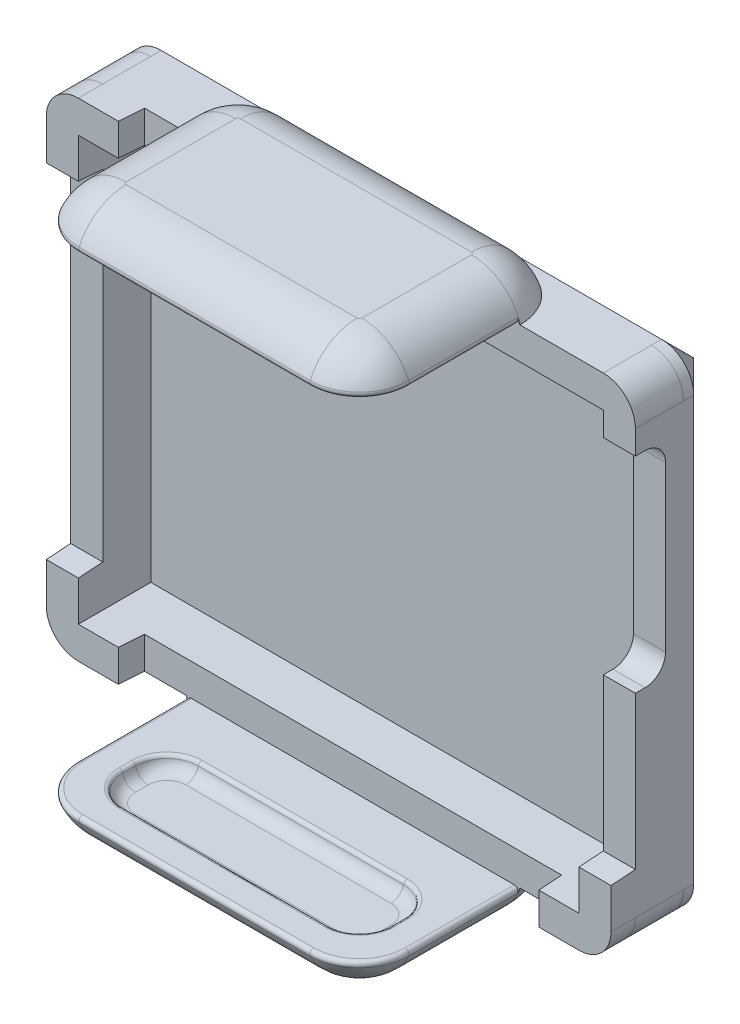
from build123d import *
from build123d.topology import SkipClean

# Parameters (mm, degrees)
WALLS_START                  = 1.526776695
WALLS_DEPTH                  = 1.87242011
BASE_START                   = 3.399196
BASE_DEPTH                   = 1.65
CUT_USB_HOLE_DEPTH           = 1.25
CHAMFER_DESQUISH_SIZE        = 1.25
SKETCH4_W                    = 13
SKETCH4_H                    = 8.27241931
EXTRUDE_TAB1_DEPTH           = 1.4
FILLET_TAB1_R                = 2
EXTRUDE_START                = -19
SKETCH4_3_W                  = 13
SKETCH4_3_H                  = 8.27241931
EXTRUDE_TAB2_DEPTH           = 1.4
FILLET_TAB2_R                = 2
FILLET_TAB_SIDES_R           = 2
CUT_TAB_HOLE_2_DEPTH         = 0.51
CUT_START                    = -19
CUT_TAB_HOLE_1_DEPTH         = 0.51
FILL_TAB_HOLES_INNER_R       = 0.5
FILLET_TAB_EDGE_R            = 0.15
EXTRUDE_START_2              = 0.95
EXTRUDE_ALIGNMENT_TABS_DEPTH = 0.95
DRAFT_ALIGNMENT_TABS_ANGLE   = 4
FILLET1_R                    = 0.15


with BuildPart() as part:
    # walls: read off the stored shape, not the designer's step
    # walls outline → walls (new body)
    with BuildSketch(Plane(origin=(0, 0, -0.80080358), x_dir=(-1, 0, 0), z_dir=(0, 0, -1)).offset(WALLS_START)):
        with BuildLine():
            ThreePointArc((0.25, -1.499999918), (1.13388369, -1.133883181), (1.5, -0.249999313))
            Line((1.5, -0.249999313), (1.5, 16.250000082))
            ThreePointArc((1.5, 16.250000082), (1.133883476, 17.133883558), (0.25, 17.500000082))
            Line((0.25, 17.500000082), (-19.25, 17.500000082))
            ThreePointArc((-19.25, 17.500000082), (-20.133883476, 17.133883558), (-20.5, 16.250000082))
            Line((-20.5, 16.250000082), (-20.5, -0.249999313))
            ThreePointArc((-20.5, -0.249999313), (-20.133883691, -1.133883181), (-19.25, -1.499999918))
            Line((-19.25, -1.499999918), (0.25, -1.499999918))
        make_face()
        Polygon((-19.25, -0.25), (-19.25, 16.250001374), (0.25, 16.250000073), (0.25, -0.25), align=None, mode=Mode.SUBTRACT)
    extrude(amount=WALLS_DEPTH)

    # Sketch1<3> → base (add)
    with BuildSketch(Plane(origin=(0, 0, -0.80080358), x_dir=(-1, 0, 0), z_dir=(0, 0, -1)).offset(BASE_START)):
        with BuildLine():
            Line((0.25, 17.5), (-19.25, 17.5))
            ThreePointArc((-19.25, 17.5), (-20.133883476, 17.133883476), (-20.5, 16.25))
            Line((-20.5, 16.25), (-20.5, -0.25))
            ThreePointArc((-20.5, -0.25), (-20.133883476, -1.133883476), (-19.25, -1.5))
            Line((-19.25, -1.5), (0.25, -1.5))
            ThreePointArc((0.25, -1.5), (1.133883476, -1.133883476), (1.5, -0.25))
            Line((1.5, -0.25), (1.5, 16.25))
            ThreePointArc((1.5, 16.25), (1.133883476, 17.133883476), (0.25, 17.5))
        make_face()
    extrude(amount=BASE_DEPTH)

    # Sketch3 → cut usb hole (cut)
    with BuildSketch(Plane(origin=(20.5, 0, 0), x_dir=(0, 0, -1), z_dir=(1, 0, 0))):
        with BuildLine():
            Line((1.388671546, 15.085909165), (0.785118155, 14.482355774))
            ThreePointArc((0.785118155, 14.482355774), (0.611699954, 14.222817095), (0.55080358, 13.916670349))
            Line((0.55080358, 13.916670349), (0.55080358, 11.33022374))
            Line((0.55080358, 11.33022374), (0.55080358, 11.31022374))
            Line((0.55080358, 11.31022374), (0.55080358, 8.723777131))
            ThreePointArc((0.55080358, 8.723777131), (0.611699954, 8.417630385), (0.785118155, 8.158091706))
            Line((0.785118155, 8.158091706), (1.388671546, 7.554538315))
            ThreePointArc((1.388671546, 7.554538315), (1.648210225, 7.381120114), (1.954356971, 7.32022374))
            Line((1.954356971, 7.32022374), (2.70080358, 7.32022374))
            ThreePointArc((2.70080358, 7.32022374), (3.266489005, 7.554538315), (3.50080358, 8.12022374))
            Line((3.50080358, 8.12022374), (3.50080358, 14.52022374))
            ThreePointArc((3.50080358, 14.52022374), (3.266489005, 15.085909165), (2.70080358, 15.32022374))
            Line((2.70080358, 15.32022374), (1.954356971, 15.32022374))
            ThreePointArc((1.954356971, 15.32022374), (1.648210225, 15.259327366), (1.388671546, 15.085909165))
        make_face()
    extrude(amount=-CUT_USB_HOLE_DEPTH, mode=Mode.SUBTRACT)

    # chamfer desquish
    chamfer_desquish_edges = [part.edges().sort_by_distance(p)[0] for p in [
        (9.5, 17.5, -5.84999958),
        (20.133883476, 17.133883476, -5.84999958),
        (-1.133883476, 17.133883476, -5.84999958),
        (20.5, 8, -5.84999958),
        (-1.5, 8, -5.84999958),
        (20.133883476, -1.133883476, -5.84999958),
        (-1.133883476, -1.133883476, -5.84999958),
        (9.5, -1.5, -5.84999958),
    ]]
    chamfer(chamfer_desquish_edges, length=CHAMFER_DESQUISH_SIZE - 0.0001)  # a hair under: the kernel refuses the full size

    # Sketch4 → extrude tab1 (add)
    with BuildSketch(Plane(origin=(0, -1.500000102, -6.6e-08), x_dir=(1, 0, 0), z_dir=(0, -0.999999999999999, -4.371140900000006e-08))):
        with Locations((9.5, -0.213790695)):
            Rectangle(SKETCH4_W, SKETCH4_H)
    extrude(amount=EXTRUDE_TAB1_DEPTH)

    # fillet tab1
    fillet_tab1_edges = [part.edges().sort_by_distance(p)[0] for p in [
        (16, -2.199999912, -4.350000446),
        (16, -2.200000273, 3.922418864),
        (3, -2.200000273, 3.922418864),
        (3, -2.199999912, -4.350000446),
    ]]
    fillet(fillet_tab1_edges, radius=FILLET_TAB1_R)

    # Sketch4<3> → extrude tab2 (add)
    with BuildSketch(Plane(origin=(0, -1.500000102, -6.6e-08), x_dir=(1, 0, 0), z_dir=(0, -0.999999999999999, -4.371140900000006e-08)).offset(EXTRUDE_START)):
        with Locations((9.5, -0.213790695)):
            Rectangle(SKETCH4_3_W, SKETCH4_3_H)
    extrude(amount=-EXTRUDE_TAB2_DEPTH)

    # fillet tab2
    fillet_tab2_edges = [part.edges().sort_by_distance(p)[0] for p in [
        (3, 18.200000088, -4.349999554),
        (3, 18.199999727, 3.922419755),
        (16, 18.199999727, 3.922419755),
        (16, 18.200000088, -4.349999554),
    ]]
    fillet(fillet_tab2_edges, radius=FILLET_TAB2_R)

    # fillet tab sides
    # the kernel refuses this fillet: 2 mm, written as the material it takes off along each edge
    with BuildSketch(Plane(origin=(5, 18.899999727, 3.922419786), x_dir=(0, 4.371140875977686e-08, -0.9999999999999991), z_dir=(1, 0, 0))) as fillet_tab_sides_piece_1:
        with BuildLine():
            CenterArc((1.907878403, -2), FILLET_TAB_SIDES_R, 90, 72.542396876)
            Line((0, -1.4), (-0.038157568, -1.388))
            ThreePointArc((-0.038157568, -1.388), (-0.04, -0.7), (-0.04, 0))
            Line((-0.04, 0), (0, 0.04))
            Line((0, 0.04), (1.907878403, 0.04))
            Line((1.907878403, 0.04), (1.907878403, 0))
        make_face()
    extrude(amount=9, mode=Mode.SUBTRACT)
    with BuildSketch(Plane(origin=(5, 18.899999814, 1.922419786), x_dir=(-1, 0, 0), z_dir=(0, 4.3711409000000074e-08, -0.9999999999999991))) as fillet_tab_sides_piece_2:
        with BuildLine():
            CenterArc((0.092121597, -2), FILLET_TAB_SIDES_R, 17.457603124, 72.542396876)
            Line((2, -1.4), (2.038157568, -1.388))
            ThreePointArc((2.038157568, -1.388), (2.04, -0.7), (2.04, 0))
            Line((2.04, 0), (2, 0.04))
            Line((2, 0.04), (0.092121597, 0.04))
            Line((0.092121597, 0.04), (0.092121597, 0))
        make_face()
    revolve(axis=Axis((5, 18.899999814, 1.922419786), (0, 0.9999999999999991, 4.3711409000000074e-08)), revolution_arc=90, mode=Mode.SUBTRACT)
    with BuildSketch(Plane(origin=(3, 18.900000001, -2.349999524), x_dir=(0, -0.999999999999999, -4.371140900000006e-08), z_dir=(0, -4.371140900000007e-08, 0.9999999999999991)), Plane(origin=(16, 18.899999814, 1.922419786), x_dir=(0, -0.999999999999999, -4.371140900000006e-08), z_dir=(0, 4.371140900000007e-08, -0.9999999999999991))) as fillet_tab_sides_piece_3:
        with BuildLine():
            CenterArc((2, 1.907878403), FILLET_TAB_SIDES_R, 180, 72.542396876)
            Line((0, 1.907878403), (-0.04, 1.907878403))
            Line((-0.04, 1.907878403), (-0.04, 0))
            Line((-0.04, 0), (0, -0.04))
            ThreePointArc((0, -0.04), (0.7, -0.04), (1.388, -0.038157568))
            Line((1.388, -0.038157568), (1.4, 0))
        make_face()
    extrude(amount=4.27241931, mode=Mode.SUBTRACT)
    with BuildSketch(Plane(origin=(5, 18.900000001, -2.349999524), x_dir=(-1, 0, 0), z_dir=(0, -4.3711409000000074e-08, 0.9999999999999991))) as fillet_tab_sides_piece_4:
        with BuildLine():
            CenterArc((0.092121623, 2), FILLET_TAB_SIDES_R, 270, 72.542394442)
            Line((0.092121623, 0), (0.092121623, -0.04))
            Line((0.092121623, -0.04), (2, -0.04))
            Line((2, -0.04), (2.04, 0))
            ThreePointArc((2.04, 0), (2.04, 0.699999959), (2.038157568, 1.387999917))
            Line((2.038157568, 1.387999917), (2, 1.399999919))
        make_face()
    revolve(axis=Axis((5, 18.900000001, -2.349999524), (0, -0.9999999999999991, -4.3711409000000074e-08)), revolution_arc=90, mode=Mode.SUBTRACT)
    with BuildSketch(Plane(origin=(14, 18.900000088, -4.349999524), x_dir=(0, -0.999999999999999, -4.371140909548948e-08), z_dir=(-1, 0, 0))) as fillet_tab_sides_piece_5:
        with BuildLine():
            CenterArc((2, 1.907878403), FILLET_TAB_SIDES_R, 180, 72.542396876)
            Line((0, 1.907878403), (-0.04, 1.907878403))
            Line((-0.04, 1.907878403), (-0.04, 0))
            Line((-0.04, 0), (0, -0.04))
            ThreePointArc((0, -0.04), (0.7, -0.04), (1.388, -0.038157568))
            Line((1.388, -0.038157568), (1.4, 0))
        make_face()
    extrude(amount=9, mode=Mode.SUBTRACT)
    with BuildSketch(Plane(origin=(14, 18.900000001, -2.349999524), x_dir=(0, 4.371140960302e-08, -0.9999999999999991), z_dir=(-1, 0, 0))) as fillet_tab_sides_piece_6:
        with BuildLine():
            CenterArc((0.092121623, 2), FILLET_TAB_SIDES_R, 270, 72.542394442)
            Line((0.092121623, 0), (0.092121623, -0.04))
            Line((0.092121623, -0.04), (2, -0.04))
            Line((2, -0.04), (2.04, 0))
            ThreePointArc((2.04, 0), (2.04, 0.699999959), (2.038157568, 1.387999917))
            Line((2.038157568, 1.387999917), (2, 1.399999919))
        make_face()
    revolve(axis=Axis((14, 18.900000001, -2.349999524), (0, -0.9999999999999991, -4.3711409000000074e-08)), revolution_arc=90, mode=Mode.SUBTRACT)
    with BuildSketch(Plane(origin=(16, -2.900000186, 1.922418833), x_dir=(0, 0.999999999999999, 4.371140900000006e-08), z_dir=(0, 4.371140900000007e-08, -0.9999999999999991)), Plane(origin=(3, -2.899999999, -2.350000477), x_dir=(0, 0.999999999999999, 4.371140900000006e-08), z_dir=(0, -4.371140900000007e-08, 0.9999999999999991))) as fillet_tab_sides_piece_7:
        with BuildLine():
            CenterArc((2, -1.907878403), FILLET_TAB_SIDES_R, 107.457603124, 72.542396876)
            Line((0, -1.907878403), (-0.04, -1.907878403))
            Line((-0.04, -1.907878403), (-0.04, 0))
            Line((-0.04, 0), (0, 0.04))
            ThreePointArc((0, 0.04), (0.7, 0.04), (1.388, 0.038157568))
            Line((1.388, 0.038157568), (1.4, 0))
        make_face()
    extrude(amount=4.27241931, mode=Mode.SUBTRACT)
    with BuildSketch(Plane(origin=(14, -2.899999999, -2.350000477), x_dir=(1, 0, 0), z_dir=(0, -4.3711409000000074e-08, 0.9999999999999991))) as fillet_tab_sides_piece_8:
        with BuildLine():
            CenterArc((0.092121572, 2), FILLET_TAB_SIDES_R, 270, 72.54239931)
            Line((0.092121572, 0), (0.092121572, -0.04))
            Line((0.092121572, -0.04), (2, -0.04))
            Line((2, -0.04), (2.04, 0))
            ThreePointArc((2.04, 0), (2.04, 0.700000041), (2.038157569, 1.388000083))
            Line((2.038157569, 1.388000083), (2, 1.400000081))
        make_face()
    revolve(axis=Axis((14, -2.899999999, -2.350000477), (0, 0.9999999999999991, 4.3711409000000074e-08)), revolution_arc=90, mode=Mode.SUBTRACT)
    with BuildSketch(Plane(origin=(14, -2.899999912, -4.350000477), x_dir=(0, 0.999999999999999, 4.371140909548948e-08), z_dir=(-1, 0, 0)), Plane(origin=(5, -2.900000273, 3.922418833), x_dir=(0, 0.999999999999999, 4.371140909548948e-08), z_dir=(1, 0, 0))) as fillet_tab_sides_piece_9:
        with BuildLine():
            CenterArc((2, -1.907878403), FILLET_TAB_SIDES_R, 107.457603124, 72.542396876)
            Line((0, -1.907878403), (-0.04, -1.907878403))
            Line((-0.04, -1.907878403), (-0.04, 0))
            Line((-0.04, 0), (0, 0.04))
            ThreePointArc((0, 0.04), (0.7, 0.04), (1.388, 0.038157568))
            Line((1.388, 0.038157568), (1.4, 0))
        make_face()
    extrude(amount=9, mode=Mode.SUBTRACT)
    with BuildSketch(Plane(origin=(5, -2.899999999, -2.350000477), x_dir=(0, 4.371140893688619e-08, -0.9999999999999991), z_dir=(1, 0, 0))) as fillet_tab_sides_piece_10:
        with BuildLine():
            CenterArc((0.092121572, 2), FILLET_TAB_SIDES_R, 270, 72.54239931)
            Line((0.092121572, 0), (0.092121572, -0.04))
            Line((0.092121572, -0.04), (2, -0.04))
            Line((2, -0.04), (2.04, 0))
            ThreePointArc((2.04, 0), (2.04, 0.700000041), (2.038157569, 1.388000083))
            Line((2.038157569, 1.388000083), (2, 1.400000081))
        make_face()
    revolve(axis=Axis((5, -2.899999999, -2.350000477), (0, 0.9999999999999991, 4.3711409000000074e-08)), revolution_arc=90, mode=Mode.SUBTRACT)
    with BuildSketch(Plane(origin=(5, -2.900000186, 1.922418833), x_dir=(-1, 0, 0), z_dir=(0, 4.3711409000000074e-08, -0.9999999999999991))) as fillet_tab_sides_piece_11:
        with BuildLine():
            CenterArc((0.092121597, 2), FILLET_TAB_SIDES_R, 270, 72.542396876)
            Line((0.092121597, 0), (0.092121597, -0.04))
            Line((0.092121597, -0.04), (2, -0.04))
            Line((2, -0.04), (2.04, 0))
            ThreePointArc((2.04, 0), (2.04, 0.7), (2.038157568, 1.388))
            Line((2.038157568, 1.388), (2, 1.4))
        make_face()
    revolve(axis=Axis((5, -2.900000186, 1.922418833), (0, 0.9999999999999991, 4.3711409000000074e-08)), revolution_arc=90, mode=Mode.SUBTRACT)
    with BuildSketch(Plane(origin=(14, 18.899999814, 1.922419786), x_dir=(1, 0, 0), z_dir=(0, 4.3711409000000074e-08, -0.9999999999999991))) as fillet_tab_sides_piece_12:
        with BuildLine():
            CenterArc((0.092121597, 2), FILLET_TAB_SIDES_R, 270, 72.542396876)
            Line((2, 1.4), (2.038157568, 1.388))
            ThreePointArc((2.038157568, 1.388), (2.04, 0.7), (2.04, 0))
            Line((2.04, 0), (2, -0.04))
            Line((2, -0.04), (0.092121597, -0.04))
            Line((0.092121597, -0.04), (0.092121597, 0))
        make_face()
    revolve(axis=Axis((14, 18.899999814, 1.922419786), (0, -0.9999999999999991, -4.3711409000000074e-08)), revolution_arc=90, mode=Mode.SUBTRACT)
    with BuildSketch(Plane(origin=(14, -2.900000186, 1.922418833), x_dir=(1, 0, 0), z_dir=(0, 4.3711409000000074e-08, -0.9999999999999991))) as fillet_tab_sides_piece_13:
        with BuildLine():
            CenterArc((0.092121597, -2), FILLET_TAB_SIDES_R, 17.457603124, 72.542396876)
            Line((0.092121597, 0), (0.092121597, 0.04))
            Line((0.092121597, 0.04), (2, 0.04))
            Line((2, 0.04), (2.04, 0))
            ThreePointArc((2.04, 0), (2.04, -0.7), (2.038157568, -1.388))
            Line((2.038157568, -1.388), (2, -1.4))
        make_face()
    revolve(axis=Axis((14, -2.900000186, 1.922418833), (0, -0.9999999999999991, -4.3711409000000074e-08)), revolution_arc=90, mode=Mode.SUBTRACT)

    # Sketch4<4> → cut tab hole 2 (cut)
    with BuildSketch(Plane(origin=(0, -1.500000102, -6.6e-08), x_dir=(1, 0, 0), z_dir=(0, -0.999999999999999, -4.371140900000006e-08))):
        with BuildLine():
            Line((5.5, -0.308793347), (13.5, -0.308793347))
            add(Edge.make_bspline(
                [(13.5, -0.308793347), (13.745187146, -0.308793347), (13.971164664, -0.215072844), (14.197889024, -0.1210426), (14.370598743, 0.051820561), (14.544080837, 0.225456783), (14.63749199, 0.451254746), (14.731212403, 0.677800267), (14.731212307, 0.92241933)],
                knots=[0, 0, 0, 0.25, 0.25, 0.5, 0.5, 0.75, 0.75, 0.99999988, 0.99999988, 0.99999988], degree=2))
            Line((14.731212307, 0.92241933), (14.731212307, 1.422419482))
            add(Edge.make_bspline(
                [(14.731212307, 1.422419482), (14.731212203, 1.667606496), (14.6374917, 1.893583873), (14.543461457, 2.120308091), (14.370598386, 2.293017715), (14.196962255, 2.466499713), (13.971164431, 2.55991086), (13.744619049, 2.653631266), (13.5, 2.653631266)],
                knots=[0, 0, 0, 0.25, 0.25, 0.5, 0.5, 0.75, 0.75, 1, 1, 1], degree=2))
            Line((13.5, 2.653631266), (5.5, 2.653631266))
            add(Edge.make_bspline(
                [(5.5, 2.653631266), (5.25481306, 2.653631266), (5.028835701, 2.559910915), (4.802111501, 2.465880823), (4.629401816, 2.293017918), (4.455919756, 2.119381953), (4.362508464, 1.89358427), (4.268787911, 1.667039029), (4.268787693, 1.422420054)],
                knots=[0, 0, 0, 0.25, 0.25, 0.5, 0.5, 0.75, 0.75, 1, 1, 1], degree=2))
            Line((4.268787693, 1.422420054), (4.268787693, 0.922419447))
            add(Edge.make_bspline(
                [(4.268787693, 0.922419447), (4.268787596, 0.677232302), (4.36250801, 0.451254746), (4.456538164, 0.224530349), (4.629401257, 0.051820561), (4.80303741, -0.121661601), (5.028835336, -0.215072844), (5.25538082, -0.308793347), (5.5, -0.308793347)],
                knots=[0, 0, 0, 0.25, 0.25, 0.5, 0.5, 0.75, 0.75, 1, 1, 1], degree=2))
        make_face()
    extrude(amount=CUT_TAB_HOLE_2_DEPTH, mode=Mode.SUBTRACT)

    # Sketch4<6> → cut tab hole 1 (cut)
    with BuildSketch(Plane(origin=(0, -1.500000102, -6.6e-08), x_dir=(1, 0, 0), z_dir=(0, -0.999999999999999, -4.371140900000006e-08)).offset(CUT_START)):
        with BuildLine():
            Line((5.5, -0.308793347), (13.5, -0.308793347))
            add(Edge.make_bspline(
                [(13.5, -0.308793347), (13.745187146, -0.308793347), (13.971164664, -0.215072844), (14.197889024, -0.1210426), (14.370598743, 0.051820561), (14.544080837, 0.225456783), (14.63749199, 0.451254746), (14.731212403, 0.677800267), (14.731212307, 0.92241933)],
                knots=[0, 0, 0, 0.25, 0.25, 0.5, 0.5, 0.75, 0.75, 0.99999988, 0.99999988, 0.99999988], degree=2))
            Line((14.731212307, 0.92241933), (14.731212307, 1.422419482))
            add(Edge.make_bspline(
                [(14.731212307, 1.422419482), (14.731212203, 1.667606496), (14.6374917, 1.893583873), (14.543461457, 2.120308091), (14.370598386, 2.293017715), (14.196962255, 2.466499713), (13.971164431, 2.55991086), (13.744619049, 2.653631266), (13.5, 2.653631266)],
                knots=[0, 0, 0, 0.25, 0.25, 0.5, 0.5, 0.75, 0.75, 1, 1, 1], degree=2))
            Line((13.5, 2.653631266), (5.5, 2.653631266))
            add(Edge.make_bspline(
                [(5.5, 2.653631266), (5.25481306, 2.653631266), (5.028835701, 2.559910915), (4.802111501, 2.465880823), (4.629401816, 2.293017918), (4.455919756, 2.119381953), (4.362508464, 1.89358427), (4.268787911, 1.667039029), (4.268787693, 1.422420054)],
                knots=[0, 0, 0, 0.25, 0.25, 0.5, 0.5, 0.75, 0.75, 1, 1, 1], degree=2))
            Line((4.268787693, 1.422420054), (4.268787693, 0.922419447))
            add(Edge.make_bspline(
                [(4.268787693, 0.922419447), (4.268787596, 0.677232302), (4.36250801, 0.451254746), (4.456538164, 0.224530349), (4.629401257, 0.051820561), (4.80303741, -0.121661601), (5.028835336, -0.215072844), (5.25538082, -0.308793347), (5.5, -0.308793347)],
                knots=[0, 0, 0, 0.25, 0.25, 0.5, 0.5, 0.75, 0.75, 1, 1, 1], degree=2))
        make_face()
    extrude(amount=-CUT_TAB_HOLE_1_DEPTH, mode=Mode.SUBTRACT)

    # fill tab holes inner
    fill_tab_holes_inner_edges = [part.edges().sort_by_distance(p)[0] for p in [
        (9.5, -2.010000088, -0.308793435),
        (14.731212307, -2.010000153, 1.172419318),
        (9.5, -2.010000218, 2.653631178),
        (4.268787693, -2.010000153, 1.172419663),
        (4.629396119, -2.010000104, 0.051825606),
        (14.370593569, -2.010000104, 0.051815294),
        (14.370603524, -2.010000202, 2.293012494),
        (4.629406949, -2.010000202, 2.293022968),
        (4.629396119, 18.009999896, 0.051826482),
        (4.268787693, 18.009999847, 1.172420538),
        (4.629406949, 18.009999798, 2.293023843),
        (9.5, 18.009999782, 2.653632054),
        (14.370603524, 18.009999798, 2.293013369),
        (14.731212307, 18.009999847, 1.172420193),
        (14.370593569, 18.009999896, 0.05181617),
        (9.5, 18.009999912, -0.30879256),
    ]]
    fillet(fill_tab_holes_inner_edges, radius=FILL_TAB_HOLES_INNER_R)

    # fillet tab edge
    # the kernel refuses this fillet: 0.15 mm, written as the material it takes off along each edge
    with BuildSketch(Plane(origin=(16, -1.500000186, 1.922418894), x_dir=(-1, 0, 0), z_dir=(0, 4.371140900000007e-08, -0.9999999999999991)), Plane(origin=(3, -1.5, -2.327580275), x_dir=(1, 0, 0), z_dir=(0, -4.371140900000007e-08, 0.9999999999999991))) as fillet_tab_edge_piece_1:
        with BuildLine():
            CenterArc((0.21672495, -0.15), FILLET_TAB_EDGE_R, 90, 113.916534422)
            ThreePointArc((0.0796044, -0.210810811), (0.036830836, -0.106527424), (0, 0))
            Line((0, 0), (0.21672495, 0))
        make_face()
    extrude(amount=4.249999169, mode=Mode.SUBTRACT)
    with BuildSketch(Plane(origin=(5, -1.500000273, 3.922418894), x_dir=(0, 4.37114092198387e-08, -0.9999999999999991), z_dir=(1, 0, 0))) as fillet_tab_edge_piece_2:
        with BuildLine():
            CenterArc((0.21672495, -0.15), FILLET_TAB_EDGE_R, 90, 113.916534422)
            ThreePointArc((0.0796044, -0.210810811), (0.036830836, -0.106527424), (0, 0))
            Line((0, 0), (0.21672495, 0))
        make_face()
    extrude(amount=9, mode=Mode.SUBTRACT)
    with BuildSketch(Plane(origin=(14, -1.500000186, 1.922418894), x_dir=(1, 0, 0), z_dir=(0, 4.3711409000000074e-08, -0.9999999999999991))) as fillet_tab_edge_piece_3:
        with BuildLine():
            CenterArc((1.78327505, 0.15), FILLET_TAB_EDGE_R, 270, 113.916534422)
            ThreePointArc((1.9203956, 0.210810811), (1.963169164, 0.106527424), (2, 0))
            Line((2, 0), (1.78327505, 0))
        make_face()
    revolve(axis=Axis((14, -1.500000186, 1.922418894), (0, -0.9999999999999991, -4.3711409000000074e-08)), revolution_arc=90, mode=Mode.SUBTRACT)
    with BuildSketch(Plane(origin=(5, -1.500000186, 1.922418894), x_dir=(-1, 0, 0), z_dir=(0, 4.3711409000000074e-08, -0.9999999999999991))) as fillet_tab_edge_piece_4:
        with BuildLine():
            CenterArc((1.78327505, -0.15), FILLET_TAB_EDGE_R, 336.083465578, 113.916534422)
            ThreePointArc((1.9203956, -0.210810811), (1.963169164, -0.106527424), (2, 0))
            Line((2, 0), (1.78327505, 0))
        make_face()
    revolve(axis=Axis((5, -1.500000186, 1.922418894), (0, 0.9999999999999991, 4.3711409000000074e-08)), revolution_arc=90, mode=Mode.SUBTRACT)
    with BuildSketch(Plane(origin=(3, 17.5, -2.327580275), x_dir=(1, 0, 0), z_dir=(0, -4.371140900000007e-08, 0.9999999999999991)), Plane(origin=(16, 17.499999814, 1.922419725), x_dir=(-1, 0, 0), z_dir=(0, 4.371140900000007e-08, -0.9999999999999991))) as fillet_tab_edge_piece_5:
        with BuildLine():
            CenterArc((0.21672495, 0.15), FILLET_TAB_EDGE_R, 156.083465578, 113.916534422)
            ThreePointArc((0.0796044, 0.210810811), (0.036830836, 0.106527424), (0, 0))
            Line((0, 0), (0.21672495, 0))
        make_face()
    extrude(amount=4.25, mode=Mode.SUBTRACT)
    with BuildSketch(Plane(origin=(5, 17.499999727, 3.922419725), x_dir=(0, 4.371139590085794e-08, -0.9999999999999991), z_dir=(1, 0, 0))) as fillet_tab_edge_piece_6:
        with BuildLine():
            CenterArc((0.21672495, 0.15), FILLET_TAB_EDGE_R, 156.083465578, 113.916534422)
            ThreePointArc((0.0796044, 0.210810811), (0.036830836, 0.106527424), (0, 0))
            Line((0, 0), (0.21672495, 0))
        make_face()
    extrude(amount=9, mode=Mode.SUBTRACT)
    with BuildSketch(Plane(origin=(14, 17.499999814, 1.922419725), x_dir=(1, 0, 0), z_dir=(0, 4.3711409000000074e-08, -0.9999999999999991))) as fillet_tab_edge_piece_7:
        with BuildLine():
            CenterArc((1.78327505, -0.15), FILLET_TAB_EDGE_R, 336.083465578, 113.916534422)
            ThreePointArc((1.9203956, -0.210810811), (1.963169164, -0.106527424), (2, 0))
            Line((2, 0), (1.78327505, 0))
        make_face()
    revolve(axis=Axis((14, 17.499999814, 1.922419725), (0, -0.9999999999999991, -4.3711409000000074e-08)), revolution_arc=90, mode=Mode.SUBTRACT)
    with BuildSketch(Plane(origin=(5, 17.499999814, 1.922419725), x_dir=(-1, 0, 0), z_dir=(0, 4.3711409000000074e-08, -0.9999999999999991))) as fillet_tab_edge_piece_8:
        with BuildLine():
            CenterArc((1.78327505, 0.15), FILLET_TAB_EDGE_R, 270, 113.916534422)
            ThreePointArc((1.9203956, 0.210810811), (1.963169164, 0.106527424), (2, 0))
            Line((2, 0), (1.78327505, 0))
        make_face()
    revolve(axis=Axis((5, 17.499999814, 1.922419725), (0, 0.9999999999999991, 4.3711409000000074e-08)), revolution_arc=90, mode=Mode.SUBTRACT)

    # Sketch9 → extrude alignment tabs (add)
    with SkipClean():  # the faces are left unmerged after this step: merging them gives an invalid solid
        with BuildSketch(Plane.XY.offset(-2.327580275).offset(EXTRUDE_START_2)):
            with BuildLine():
                Line((1.375, 16.25), (1.375, 17.5))
                Line((1.375, 17.5), (-0.25, 17.5))
                ThreePointArc((-0.25, 17.5), (-1.133883476, 17.133883476), (-1.5, 16.25))
                Line((-1.5, 16.25), (-1.5, 14.625))
                Line((-1.5, 14.625), (-0.25, 14.625))
                Line((-0.25, 14.625), (-0.25, 16.25))
                Line((-0.25, 16.25), (1.375, 16.25))
            make_face()
            with BuildLine():
                Line((17.625, -0.25), (17.625, -1.5))
                Line((17.625, -1.5), (19.25, -1.5))
                ThreePointArc((19.25, -1.5), (20.133883476, -1.133883476), (20.5, -0.25))
                Line((20.5, -0.25), (20.5, 1.375))
                Line((20.5, 1.375), (19.25, 1.375))
                Line((19.25, 1.375), (19.25, -0.25))
                Line((19.25, -0.25), (17.625, -0.25))
            make_face()
            with BuildLine():
                Line((-0.25, -1.5), (1.375, -1.5))
                Line((1.375, -1.5), (1.375, -0.25))
                Line((1.375, -0.25), (-0.25, -0.25))
                Line((-0.25, -0.25), (-0.25, 1.375))
                Line((-0.25, 1.375), (-1.5, 1.375))
                Line((-1.5, 1.375), (-1.5, -0.25))
                ThreePointArc((-1.5, -0.25), (-1.133883476, -1.133883476), (-0.25, -1.5))
            make_face()
        extrude(amount=-EXTRUDE_ALIGNMENT_TABS_DEPTH)

    # draft alignment tabs
    draft_alignment_tabs_faces = [part.faces().sort_by_distance(p)[0] for p in [
        (-0.875, 1.375, -1.852580275),
        (1.375, -0.875, -1.852580275),
        (17.625, -0.875, -1.852580275),
        (19.875, 1.375, -1.852580275),
        (1.375, 16.875, -1.852580275),
        (-0.875, 14.625, -1.852580275),
    ]]
    draft(draft_alignment_tabs_faces, Plane(origin=(-0.25, -0.25, -2.327580275), x_dir=(1, 0, 0), z_dir=(0, 0, 1)), DRAFT_ALIGNMENT_TABS_ANGLE)

    # Fillet1
    fillet1_edges = [part.edges().sort_by_distance(p)[0] for p in [
        (4.629396119, 17.499999896, 0.051826459),
        (9.5, 17.499999912, -0.308792582),
        (4.268787693, 17.499999847, 1.172420516),
        (14.370593569, 17.499999896, 0.051816147),
        (4.629406949, 17.499999798, 2.29302382),
        (14.731212307, 17.499999847, 1.172420171),
        (9.5, 17.499999782, 2.653632031),
        (14.370603524, 17.499999798, 2.293013347),
        (4.629396119, -1.500000104, 0.051825629),
        (9.5, -1.500000088, -0.308793412),
        (4.268787693, -1.500000153, 1.172419685),
        (14.370593569, -1.500000104, 0.051815317),
        (4.629406949, -1.500000202, 2.29302299),
        (14.731212307, -1.500000153, 1.17241934),
        (9.5, -1.500000218, 2.653631201),
        (14.370603524, -1.500000202, 2.293012517),
    ]]
    fillet(fillet1_edges, radius=FILLET1_R)


solid = part.part
